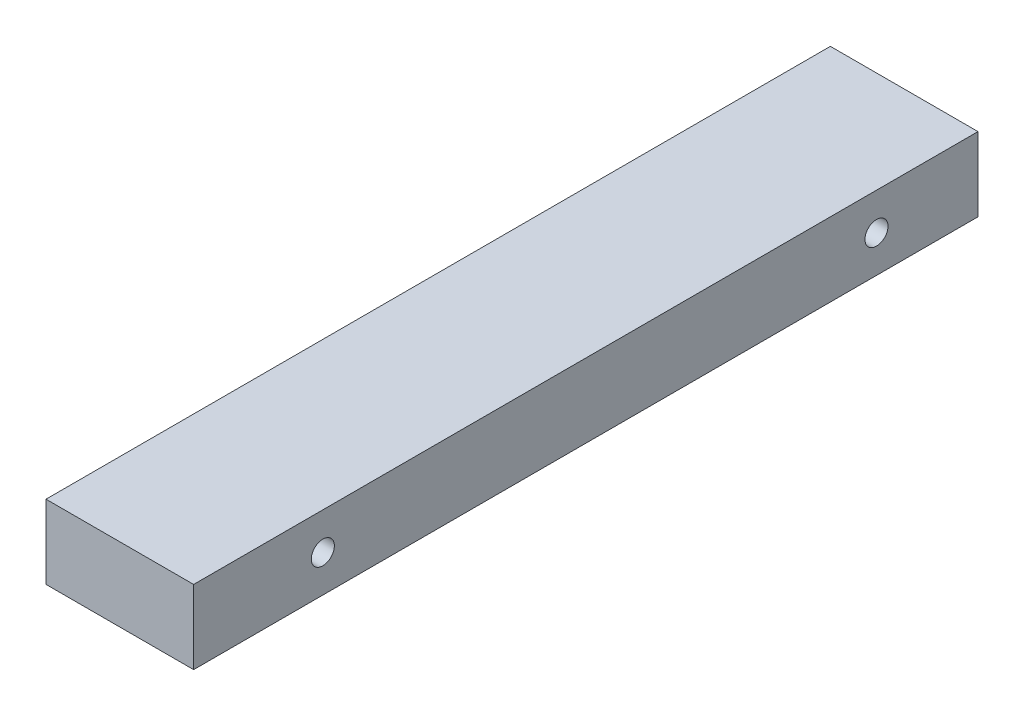
from build123d import *

# Parameters (mm, degrees)
SKETCH1_W           = 101.6
SKETCH1_H           = 50.8
BOSS_EXTRUDE1_DEPTH = 539.75
SKETCH2_R           = 7.9375
CUT_EXTRUDE1_DEPTH  = 539.75


with BuildPart() as part:
    # Sketch1 → Boss-Extrude1 (new body)
    with BuildSketch(Plane.XY):
        with Locations((-50.8, 25.4)):
            Rectangle(SKETCH1_W, SKETCH1_H)
    extrude(amount=BOSS_EXTRUDE1_DEPTH)

    # Sketch2 → Cut-Extrude1 (cut)
    with BuildSketch(Plane.ZY.offset(101.6)):
        with Locations((69.85, 25.4)):
            Circle(SKETCH2_R)
        with Locations((450.85, 25.4)):
            Circle(SKETCH2_R)
    extrude(amount=-CUT_EXTRUDE1_DEPTH, mode=Mode.SUBTRACT)


solid = part.part
